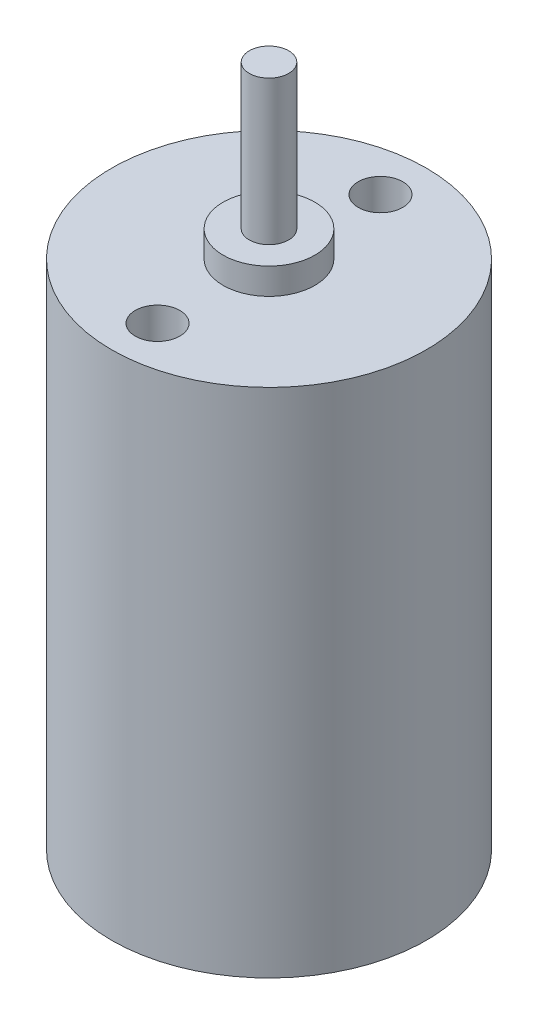
from build123d import *

# Parameters (mm, degrees)
SKETCH1_R           = 12
BOSS_EXTRUDE1_DEPTH = 39
SKETCH2_R           = 3.5
BOSS_EXTRUDE2_DEPTH = 2
SKETCH3_R           = 1.5
BOSS_EXTRUDE3_DEPTH = 11
SKETCH4_R           = 1.7
CUT_EXTRUDE1_DEPTH  = 5


with BuildPart() as part:
    # Sketch1 → Boss-Extrude1 (new body)
    with BuildSketch(Plane(origin=(0, 0, 0), x_dir=(1, 0, 0), z_dir=(0, 1, 0))):
        Circle(SKETCH1_R)
    extrude(amount=BOSS_EXTRUDE1_DEPTH)

    # Sketch2 → Boss-Extrude2 (add)
    with BuildSketch(Plane(origin=(0, 39, 0), x_dir=(1, 0, 0), z_dir=(0, 1, 0))):
        Circle(SKETCH2_R)
    extrude(amount=BOSS_EXTRUDE2_DEPTH)

    # Sketch3 → Boss-Extrude3 (add)
    with BuildSketch(Plane(origin=(0, 41, 0), x_dir=(1, 0, 0), z_dir=(0, 1, 0))):
        Circle(SKETCH3_R)
    extrude(amount=BOSS_EXTRUDE3_DEPTH)

    # Sketch4 → Cut-Extrude1 (cut)
    with BuildSketch(Plane(origin=(0, 39, 0), x_dir=(1, 0, 0), z_dir=(0, 1, 0))):
        with Locations((0, 8.5)):
            Circle(SKETCH4_R)
        with Locations((0, -8.5)):
            Circle(SKETCH4_R)
    extrude(amount=-CUT_EXTRUDE1_DEPTH, mode=Mode.SUBTRACT)


solid = part.part
